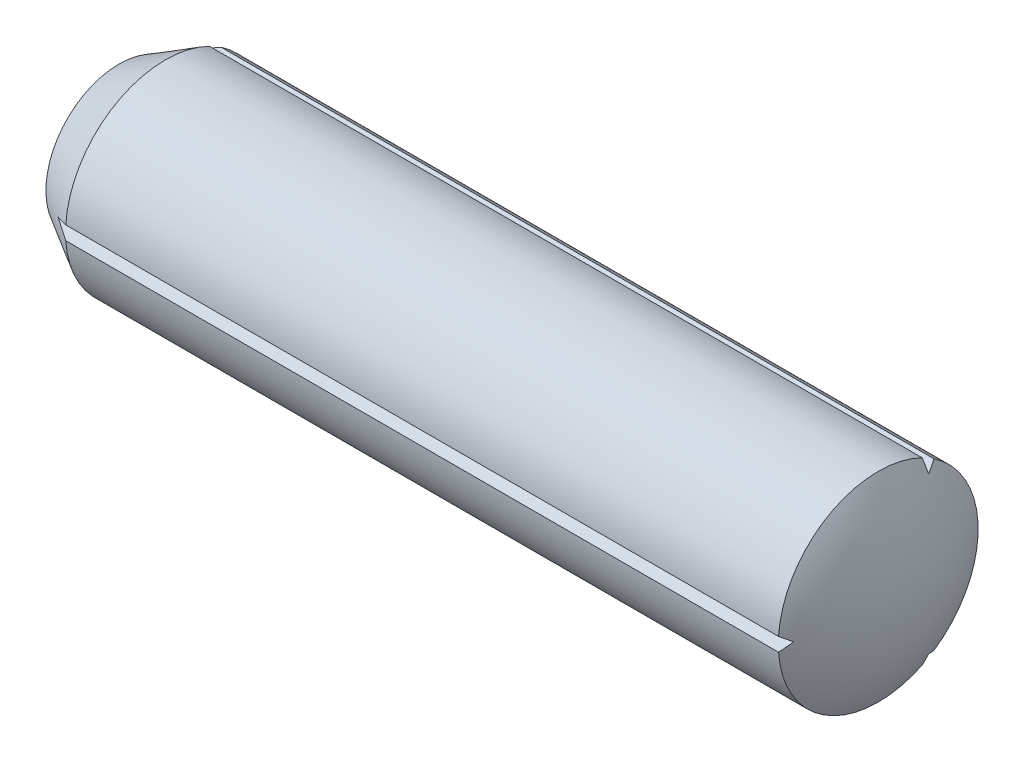
from build123d import *

# Parameters (mm, degrees)
CUT_EXTRUDE1_DEPTH = 102.550480058
CIRPATTERN2_COUNT  = 3


with BuildPart() as part:
    # Sketch1 → Base-Revolve (revolve)
    with BuildSketch(Plane.XY):
        with BuildLine():
            Line((-92.5, 12.5), (-98.294957108, 9.154279954))
            ThreePointArc((-98.294957108, 9.154279954), (-99.46916936, 5.271532335), (-100, 1.25))
            Line((-100, 1.25), (-100, 0))
            Line((-100, 0), (0, 0))
            ThreePointArc((0, 0), (-0.851854343, 6.470476128), (-3.349364905, 12.5))
            Line((-3.349364905, 12.5), (-92.5, 12.5))
        make_face()
    revolve(axis=Axis((-117, 0, 0), (1, 0, 0)))

    # Sketch2 → Cut-Extrude1 (cut, through all)
    with BuildSketch(Plane(origin=(0, 0, 0), x_dir=(0, 0, -1), z_dir=(1, 0, 0))):
        Polygon((-11.25, 0), (-12.5, 0.875259423), (-12.5, -0.875259423), align=None)
    cut_extrude1 = extrude(amount=-CUT_EXTRUDE1_DEPTH, mode=Mode.SUBTRACT)

    # CirPattern2: Cut-Extrude1 ×3 about axis
    cirpattern2_axis = Axis((-117, 0, 0), (1, 0, 0))
    for i in range(1, CIRPATTERN2_COUNT):
        add(cut_extrude1.rotate(cirpattern2_axis, i * 360 / CIRPATTERN2_COUNT), mode=Mode.SUBTRACT)


solid = part.part
